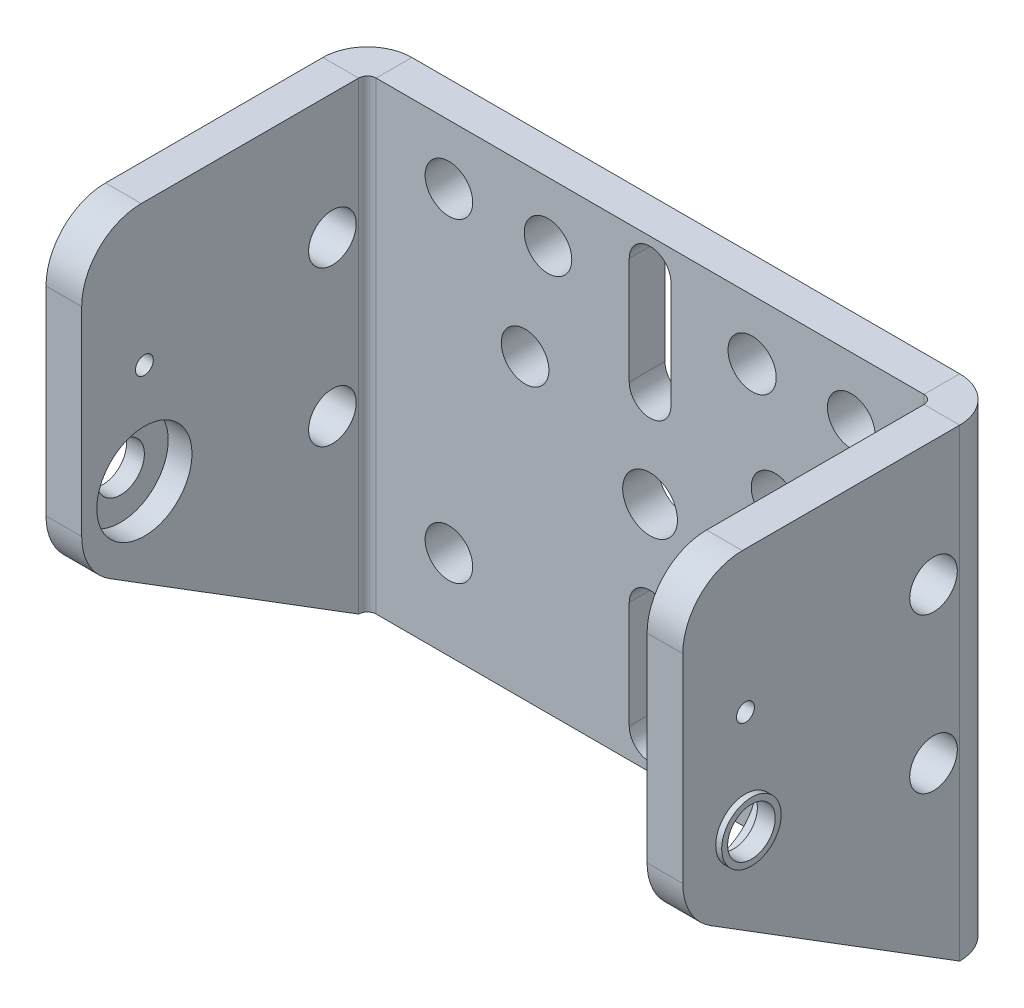
from build123d import *

# Parameters (mm, degrees)
ESBO_O1_W                        = 47.5
ESBO_O1_H                        = 39
FLANGE_BASE1_DEPTH               = 3
ESBO_O6_R                        = 2.3
CORTE_EXTRUS_O1_DEPTH            = 10
ARESTA_FLANGE1_STRIP_W           = 13.4732
ARESTA_FLANGE1_STRIP_H           = 3
ARESTA_FLANGE1_STRIP_CUT_DEPTH   = 39
ARESTA_FLANGE1_STRIP_2_W         = 13.4732
ARESTA_FLANGE1_STRIP_2_H         = 3
ARESTA_FLANGE1_STRIP_CUT_2_DEPTH = 39
ARESTA_FLANGE1_DEPTH             = 39
ARESTA_FLANGE1_BEND_DEPTH        = 39
ESBO_O13_R                       = 2
ESBO_O13_R_2                     = 0.75
CORTE_EXTRUS_O2_DEPTH            = 70
FILETE1_R                        = 5
ESBO_O14_R                       = 1.997873176
ESBO_O14_R_2                     = 2.026064888
ESBO_O14_R_3                     = 2
CORTE_EXTRUS_O4_DEPTH            = 15.5
BOSS_EXTRUDE1_START              = 0.5
SKETCH1_R                        = 2.5
SKETCH1_R_2                      = 2
BOSS_EXTRUDE1_DEPTH              = 0.5
SKETCH2_R                        = 4
CUT_EXTRUDE8_DEPTH               = 2
ESBO_O15_R                       = 2
CORTE_EXTRUS_O5_DEPTH            = 64.777464961


# Sheet-metal steps are written as plain solids
with BuildPart() as part:
    # Esboço1 → Flange-base1 (new body)
    with BuildSketch(Plane.XY):
        with Locations((3.243735783, -4.490936556)):
            Rectangle(ESBO_O1_W, ESBO_O1_H)
    extrude(amount=-FLANGE_BASE1_DEPTH)

    # Esboço6 → Corte-extrusão1 (cut)
    with BuildSketch(Plane.XY):
        with BuildLine():
            Line((-13.656264217, 8.009063444), (-13.656264217, 10.009063444))
            Line((-13.656264217, 10.009063444), (-11.656264217, 10.009063444))
            ThreePointArc((-11.656264217, 10.009063444), (-15.070477779, 11.423277006), (-13.656264217, 8.009063444))
        make_face()
        with BuildLine():
            Line((-11.656264217, 10.009063444), (-13.656264217, 10.009063444))
            Line((-13.656264217, 10.009063444), (-13.656264217, 8.009063444))
            ThreePointArc((-13.656264217, 8.009063444), (-12.242050654, 8.594849882), (-11.656264217, 10.009063444))
        make_face()
        with BuildLine():
            ThreePointArc((-11.656264217, -16.490936556), (-12.242050654, -15.076722994), (-13.656264217, -14.490936556))
            Line((-13.656264217, -14.490936556), (-13.656264217, -16.490936556))
            Line((-13.656264217, -16.490936556), (-11.656264217, -16.490936556))
        make_face()
        with BuildLine():
            Line((-13.656264217, -16.490936556), (-13.656264217, -14.490936556))
            ThreePointArc((-13.656264217, -14.490936556), (-15.070477779, -17.905150118), (-11.656264217, -16.490936556))
            Line((-11.656264217, -16.490936556), (-13.656264217, -16.490936556))
        make_face()
        with Locations((3.243735783, -4.490936556)):
            Circle(ESBO_O6_R)
        with BuildLine():
            Line((4.993735783, 10.009063444), (1.493735783, 10.009063444))
            Line((1.493735783, 10.009063444), (1.493735783, 3.523823043))
            ThreePointArc((1.493735783, 3.523823043), (3.243735783, 1.773823043), (4.993735783, 3.523823043))
            Line((4.993735783, 3.523823043), (4.993735783, 10.009063444))
        make_face()
        with BuildLine():
            Line((1.493735783, 12.523823043), (1.493735783, 10.009063444))
            Line((1.493735783, 10.009063444), (4.993735783, 10.009063444))
            Line((4.993735783, 10.009063444), (4.993735783, 12.523823043))
            ThreePointArc((4.993735783, 12.523823043), (3.243735783, 14.273823043), (1.493735783, 12.523823043))
        make_face()
        with BuildLine():
            Line((1.493735783, -12.505696155), (1.493735783, -16.490936556))
            Line((1.493735783, -16.490936556), (4.993735783, -16.490936556))
            Line((4.993735783, -16.490936556), (4.993735783, -12.505696155))
            ThreePointArc((4.993735783, -12.505696155), (3.243735783, -10.755696155), (1.493735783, -12.505696155))
        make_face()
        with BuildLine():
            Line((4.993735783, -16.490936556), (1.493735783, -16.490936556))
            Line((1.493735783, -16.490936556), (1.493735783, -21.505696155))
            ThreePointArc((1.493735783, -21.505696155), (3.243735783, -23.255696155), (4.993735783, -21.505696155))
            Line((4.993735783, -21.505696155), (4.993735783, -16.490936556))
        make_face()
        with BuildLine():
            ThreePointArc((22.143735783, -16.490936556), (21.557949346, -15.076722994), (20.143735783, -14.490936556))
            Line((20.143735783, -14.490936556), (20.143735783, -16.490936556))
            Line((20.143735783, -16.490936556), (18.143735783, -16.490936556))
            ThreePointArc((18.143735783, -16.490936556), (20.143735783, -18.490936556), (22.143735783, -16.490936556))
        make_face()
        with BuildLine():
            Line((20.143735783, -16.490936556), (20.143735783, -14.490936556))
            ThreePointArc((20.143735783, -14.490936556), (18.729522221, -15.076722994), (18.143735783, -16.490936556))
            Line((18.143735783, -16.490936556), (20.143735783, -16.490936556))
        make_face()
        with BuildLine():
            ThreePointArc((22.143735783, 10.009063444), (20.143735783, 12.009063444), (18.143735783, 10.009063444))
            Line((18.143735783, 10.009063444), (20.143735783, 10.009063444))
            Line((20.143735783, 10.009063444), (20.143735783, 8.009063444))
            ThreePointArc((20.143735783, 8.009063444), (21.557949346, 8.594849882), (22.143735783, 10.009063444))
        make_face()
        with BuildLine():
            Line((20.143735783, 10.009063444), (18.143735783, 10.009063444))
            ThreePointArc((18.143735783, 10.009063444), (18.729522221, 8.594849882), (20.143735783, 8.009063444))
            Line((20.143735783, 8.009063444), (20.143735783, 10.009063444))
        make_face()
    extrude(amount=-CORTE_EXTRUS_O1_DEPTH, mode=Mode.SUBTRACT)

    # Aresta-Flange1 strip (across the edge) → Aresta-Flange1 strip cut (cut)
    with BuildSketch(Plane(origin=(26.993735783, -23.990936556, 0), x_dir=(-1, 0, 0), z_dir=(0, 1, 0))):
        with Locations((-6, -1.5)):
            Rectangle(ARESTA_FLANGE1_STRIP_W, ARESTA_FLANGE1_STRIP_H)
    extrude(amount=ARESTA_FLANGE1_STRIP_CUT_DEPTH, mode=Mode.SUBTRACT)

    # Aresta-Flange1 strip 2 (across the edge) → Aresta-Flange1 strip cut 2 (cut)
    with BuildSketch(Plane(origin=(-20.506264217, 15.009063444, 0), x_dir=(1, 0, 0), z_dir=(0, -1, 0))):
        with Locations((-6, -1.5)):
            Rectangle(ARESTA_FLANGE1_STRIP_2_W, ARESTA_FLANGE1_STRIP_2_H)
    extrude(amount=ARESTA_FLANGE1_STRIP_CUT_2_DEPTH, mode=Mode.SUBTRACT)

    # Aresta-Flange1 section (across the edge) → Aresta-Flange1 (add)
    with BuildSketch(Plane(origin=(26.993735783, -23.990936556, 0), x_dir=(-1, 0, 0), z_dir=(0, 1, 0))):
        with BuildLine():
            Line((-3, 0.7366), (-3, 24))
            Line((-3, 24), (0, 24))
            Line((0, 24), (0, 0.7366))
            ThreePointArc((0, 0.7366), (0.215745145, 0.215745145), (0.7366, 0))
            Line((0.7366, 0), (0.7366, -3))
            ThreePointArc((0.7366, -3), (-1.905575199, -1.905575199), (-3, 0.7366))
        make_face()
    extrude(amount=ARESTA_FLANGE1_DEPTH)

    # Aresta-Flange1 section 2 (across the edge) → Aresta-Flange1 bend (add)
    with BuildSketch(Plane(origin=(-20.506264217, 15.009063444, 0), x_dir=(1, 0, 0), z_dir=(0, -1, 0))):
        with BuildLine():
            Line((-3, 0.7366), (-3, 24))
            Line((-3, 24), (0, 24))
            Line((0, 24), (0, 0.7366))
            ThreePointArc((0, 0.7366), (0.215745145, 0.215745145), (0.7366, 0))
            Line((0.7366, 0), (0.7366, -3))
            ThreePointArc((0.7366, -3), (-1.905575199, -1.905575199), (-3, 0.7366))
        make_face()
    extrude(amount=ARESTA_FLANGE1_BEND_DEPTH)

    # Esboço13 → Corte-extrusão2 (cut)
    with BuildSketch(Plane.ZY.offset(23.506264217)):
        with Locations((18.734737, -5.325205188)):
            Circle(ESBO_O13_R)
        with Locations((18.734737, 3.124794812)):
            Circle(ESBO_O13_R_2)
        Polygon((0.7366, -23.990936556), (24, -23.990936556), (24, -9.490936556), align=None)
    extrude(amount=-CORTE_EXTRUS_O2_DEPTH, mode=Mode.SUBTRACT)

    # Filete1
    filete1_edges = [part.edges().sort_by_distance(p)[0] for p in [
        (28.493735783, 15.009063444, 24),
        (-22.006264217, 15.009063444, 24),
        (-22.006264217, -9.490936556, 24),
        (28.493735783, -9.490936556, 24),
    ]]
    fillet(filete1_edges, radius=FILETE1_R)

    # Esboço14 → Corte-extrusão4 (cut)
    with BuildSketch(Plane.XY):
        with Locations((-5.331264217, 10.009063444)):
            Circle(ESBO_O14_R)
        with Locations((11.818735783, 10.009063444)):
            Circle(ESBO_O14_R_2)
        with Locations((13.743735783, 1.009063444)):
            Circle(ESBO_O14_R_3)
        with Locations((-7.256264217, 1.009063444)):
            Circle(ESBO_O14_R_3)
    extrude(amount=-CORTE_EXTRUS_O4_DEPTH, mode=Mode.SUBTRACT)

    # Sketch1 → Boss-Extrude1 (add)
    with BuildSketch(Plane.ZY.offset(23.506264217).offset(BOSS_EXTRUDE1_START)):
        with Locations(Location((18.734737, -5.325205188, 0), (0, 0, 180))):
            Circle(SKETCH1_R)
        with Locations((18.734737, -5.325205188)):
            Circle(SKETCH1_R_2, mode=Mode.SUBTRACT)
    boss_extrude1 = extrude(amount=-BOSS_EXTRUDE1_DEPTH)

    # Sketch2 → Cut-Extrude8 (cut)
    with BuildSketch(Plane(origin=(-20.506264217, 0, 0), x_dir=(0, 0, -1), z_dir=(1, 0, 0))):
        with Locations((-18.734737, -5.325205188)):
            Circle(SKETCH2_R)
    cut_extrude8 = extrude(amount=-CUT_EXTRUDE8_DEPTH, mode=Mode.SUBTRACT)

    # Mirror1: Boss-Extrude1, Cut-Extrude8 across plane
    add(boss_extrude1.mirror(Plane.ZY.offset(-3.243735783)))
    add(cut_extrude8.mirror(Plane.ZY.offset(-3.243735783)), mode=Mode.SUBTRACT)

    # Esboço15 → Corte-extrusão5 (cut, through all)
    with BuildSketch(Plane.ZY.offset(23.506264217)):
        with Locations((2.9366, 4.509063444)):
            Circle(ESBO_O15_R)
        with Locations((2.9366, -8.490936556)):
            Circle(ESBO_O15_R)
    extrude(amount=-CORTE_EXTRUS_O5_DEPTH, mode=Mode.SUBTRACT)


solid = part.part
